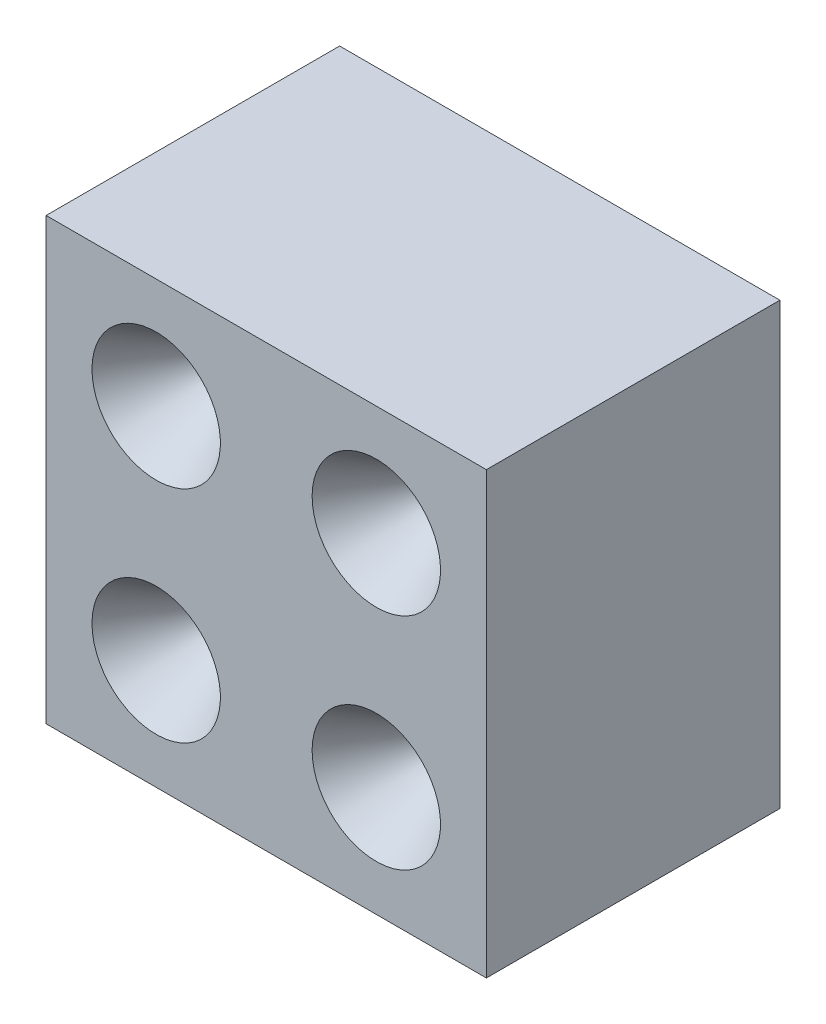
from build123d import *

# Parameters (mm, degrees)
SKETCH1_W            = 3048
SKETCH1_H            = 3048
BOSS_EXTRUDE1_DEPTH  = 2032
LPATTERN1_COUNT      = 2
LPATTERN1_PITCH      = 1524
LPATTERN1_COUNT_DIR2 = 2
LPATTERN1_PITCH_DIR2 = 1524


with BuildPart() as part:
    # Sketch1 → Boss-Extrude1 (new body)
    with BuildSketch(Plane.XY):
        with Locations((1524, 1524)):
            Rectangle(SKETCH1_W, SKETCH1_H)
    extrude(amount=BOSS_EXTRUDE1_DEPTH)

    # Cut-Loft1: read off the stored shape, not the designer's step
    # Cut-Loft1: loft between two sections, ruled curve by curve
    cut_loft1_from = [
        Edge.make_bspline([(1205.529987554, 2256.650380911, 2032), (1146.830749375, 1369.590405804, 2032), (259.770774268, 1428.289643982, 2032), (318.470012446, 2315.349619089, 2032), (377.169250625, 3202.409594196, 2032), (1264.229225732, 3143.710356018, 2032), (1205.529987554, 2256.650380911, 2032)], [0, 0, 0, 0, 0.5, 0.5, 0.5, 1, 1, 1, 1], 3, [1, 0.333333333, 0.333333333, 1, 0.333333333, 0.333333333, 1]),
    ]
    cut_loft1_to = [
        Edge.make_bspline([(885.845653168, 2314.129240859, 1524), (942.104134886, 2066.437934522, 1524), (694.412828549, 2010.179452804, 1524), (638.154346832, 2257.870759141, 1524), (581.895865114, 2505.562065478, 1524), (829.587171451, 2561.820547196, 1524), (885.845653168, 2314.129240859, 1524)], [0, 0, 0, 0, 0.5, 0.5, 0.5, 1, 1, 1, 1], 3, [1, 0.333333333, 0.333333333, 1, 0.333333333, 0.333333333, 1]),
    ]
    cut_loft1 = Solid(Shell([*[Face.make_surface_from_curves(cut_loft1_from[k], cut_loft1_to[k]) for k in range(1)], Face(Wire(cut_loft1_from)), Face(Wire(cut_loft1_to))]))
    add(cut_loft1, mode=Mode.SUBTRACT)

    # LPattern1: Cut-Loft1 2 × 2
    with Locations(*[(i * LPATTERN1_PITCH, -j * LPATTERN1_PITCH_DIR2, 0) for i in range(LPATTERN1_COUNT) for j in range(LPATTERN1_COUNT_DIR2) if (i, j) != (0, 0)]):
        add(cut_loft1, mode=Mode.SUBTRACT)


solid = part.part
